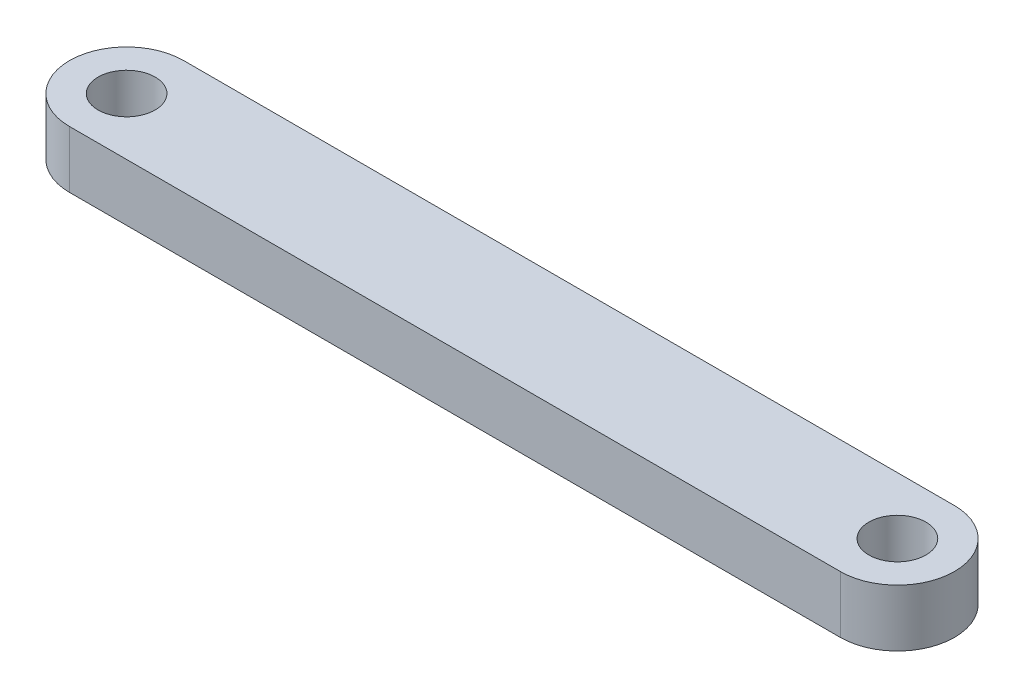
from build123d import *

# Parameters (mm, degrees)
SKETCH1_R           = 50
BOSS_EXTRUDE1_DEPTH = 50


with BuildPart() as part:
    # Sketch1 → Boss-Extrude1 (new, symmetric)
    with BuildSketch(Plane(origin=(0, 0, 0), x_dir=(1, 0, 0), z_dir=(0, 1, 0))):
        with BuildLine():
            Line((-675, 100), (675, 100))
            ThreePointArc((675, 100), (775, 0), (675, -100))
            Line((675, -100), (-675, -100))
            ThreePointArc((-675, -100), (-775, 0), (-675, 100))
        make_face()
        with Locations((-675, 0)):
            Circle(SKETCH1_R, mode=Mode.SUBTRACT)
        with Locations((675, 0)):
            Circle(SKETCH1_R, mode=Mode.SUBTRACT)
    extrude(amount=BOSS_EXTRUDE1_DEPTH, both=True)


solid = part.part
